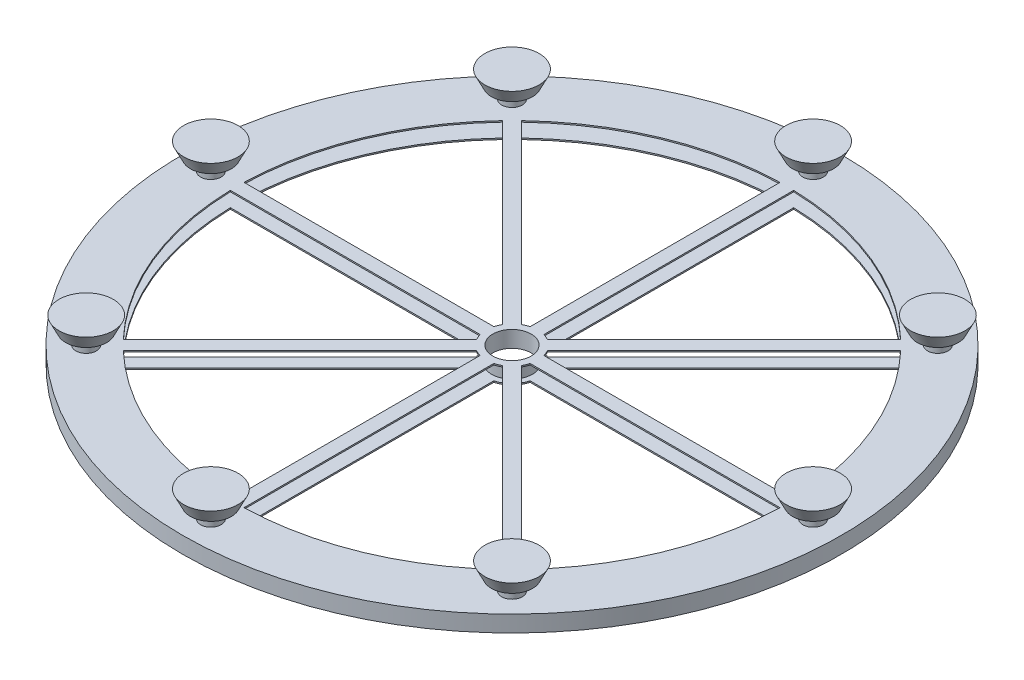
from build123d import *

# Parameters (mm, degrees)
REVOLVE_THIN1_START           = -27.94
REVOLVE_THIN1_OUTLINE_R       = 612.14
REVOLVE_THIN1_OUTLINE_R_2     = 35.56
REVOLVE_THIN1_DEPTH           = 2.54
REVOLVE_THIN1_2_OUTLINE_R     = 612.14
REVOLVE_THIN1_2_OUTLINE_R_2   = 35.56
REVOLVE_THIN1_2_DEPTH         = 2.54
REVOLVE_THIN1_START_2         = -25.4
REVOLVE_THIN1_3_OUTLINE_R     = 612.14
REVOLVE_THIN1_3_OUTLINE_R_2   = 609.6
REVOLVE_THIN1_3_OUTLINE_R_3   = 38.1
REVOLVE_THIN1_3_OUTLINE_R_4   = 35.56
REVOLVE_THIN1_3_DEPTH         = 25.4
CUT_EXTRUDE4_DEPTH            = 254
SKETCH4_R                     = 19.05
BOSS_EXTRUDE1_DEPTH           = 25.4
SKETCH5_R                     = 38.1
BOSS_EXTRUDE2_DEPTH           = 25.4
BOSS_EXTRUDE2_DRAFT           = -26
BOSS_EXTRUDE2_PROFILE_2_DEPTH = 25.4
BOSS_EXTRUDE2_PROFILE_2_DRAFT = -26
BOSS_EXTRUDE2_PROFILE_3_DEPTH = 25.4
BOSS_EXTRUDE2_PROFILE_3_DRAFT = -26
BOSS_EXTRUDE2_PROFILE_4_DEPTH = 25.4
BOSS_EXTRUDE2_PROFILE_4_DRAFT = -26
BOSS_EXTRUDE2_PROFILE_5_DEPTH = 25.4
BOSS_EXTRUDE2_PROFILE_5_DRAFT = -26
BOSS_EXTRUDE2_PROFILE_6_DEPTH = 25.4
BOSS_EXTRUDE2_PROFILE_6_DRAFT = -26
BOSS_EXTRUDE2_PROFILE_7_DEPTH = 25.4
BOSS_EXTRUDE2_PROFILE_7_DRAFT = -26
BOSS_EXTRUDE2_PROFILE_8_DEPTH = 25.4
BOSS_EXTRUDE2_PROFILE_8_DRAFT = -26
FILLET1_R                     = 2.54
FILLET2_R                     = 2.54


# Read off the part's stored shape, not the designer's step: Revolve-Thin1
with BuildPart() as part:
    # Revolve-Thin1 outline → Revolve-Thin1 (new body)
    with BuildSketch(Plane(origin=(0, 0, 0), x_dir=(1, 0, 0), z_dir=(0, 1, 0)).offset(REVOLVE_THIN1_START)):
        Circle(REVOLVE_THIN1_OUTLINE_R)
        Circle(REVOLVE_THIN1_OUTLINE_R_2, mode=Mode.SUBTRACT)
    extrude(amount=REVOLVE_THIN1_DEPTH)



with BuildPart() as body_2:
    # Revolve-Thin1 2 outline → Revolve-Thin1 2 (new body)
    with BuildSketch(Plane(origin=(0, 0, 0), x_dir=(1, 0, 0), z_dir=(0, 1, 0))):
        Circle(REVOLVE_THIN1_2_OUTLINE_R)
        Circle(REVOLVE_THIN1_2_OUTLINE_R_2, mode=Mode.SUBTRACT)
    extrude(amount=REVOLVE_THIN1_2_DEPTH)


with BuildPart() as part_1:
    add(part.part)

    add(body_2.part)  # Revolve-Thin1 3 merges body 2
    # Revolve-Thin1 3 outline → Revolve-Thin1 3 (add)
    # profile 1 of 2: a face of its own
    with BuildSketch(Plane(origin=(0, 0, 0), x_dir=(1, 0, 0), z_dir=(0, 1, 0)).offset(REVOLVE_THIN1_START_2)):
        Circle(REVOLVE_THIN1_3_OUTLINE_R)
        Circle(REVOLVE_THIN1_3_OUTLINE_R_2, mode=Mode.SUBTRACT)
    # profile 2 of 2: a face of its own
    with BuildSketch(Plane(origin=(0, 0, 0), x_dir=(1, 0, 0), z_dir=(0, 1, 0)).offset(REVOLVE_THIN1_START_2)):
        Circle(REVOLVE_THIN1_3_OUTLINE_R_3)
        Circle(REVOLVE_THIN1_3_OUTLINE_R_4, mode=Mode.SUBTRACT)
    extrude(amount=REVOLVE_THIN1_3_DEPTH)

    # Sketch3 → Cut-Extrude4 (cut)
    with BuildSketch(Plane(origin=(0, 2.54, 0), x_dir=(1, 0, 0), z_dir=(0, 1, 0))):
        with BuildLine():
            ThreePointArc((-12.707885841, 46.475796004), (-18.407169885, 44.527138619), (-23.818795726, 41.882632999))
            Line((-23.818795726, 41.882632999), (-351.960232421, 370.024069694))
            ThreePointArc((-351.960232421, 370.024069694), (-195.398846018, 471.818935963), (-12.708491222, 510.521607387))
            Line((-12.708491222, 510.521607387), (-12.707885841, 46.475796004))
        make_face()
        with BuildLine():
            Line((23.877518263, 41.849182768), (352.007030204, 369.979550847))
            ThreePointArc((352.007030204, 369.979550847), (195.458520056, 471.794218167), (12.77306183, 510.519995935))
            Line((12.77306183, 510.519995935), (12.77306183, 46.457925785))
            ThreePointArc((12.77306183, 46.457925785), (18.469607017, 44.501276312), (23.877518263, 41.849182768))
        make_face()
        with BuildLine():
            Line((46.475796004, 12.707885841), (510.521607387, 12.708491222))
            ThreePointArc((510.521607387, 12.708491222), (471.818935963, 195.398846018), (370.024069694, 351.960232421))
            Line((370.024069694, 351.960232421), (41.882632999, 23.818795726))
            ThreePointArc((41.882632999, 23.818795726), (44.527138619, 18.407169885), (46.475796004, 12.707885841))
        make_face()
        with BuildLine():
            Line((41.849182768, -23.877518263), (369.979550847, -352.007030204))
            ThreePointArc((369.979550847, -352.007030204), (471.794218167, -195.458520056), (510.519995935, -12.77306183))
            Line((510.519995935, -12.77306183), (46.457925785, -12.77306183))
            ThreePointArc((46.457925785, -12.77306183), (44.501276312, -18.469607017), (41.849182768, -23.877518263))
        make_face()
        with BuildLine():
            Line((12.707885841, -46.475796004), (12.708491222, -510.521607387))
            ThreePointArc((12.708491222, -510.521607387), (195.398846018, -471.818935963), (351.960232421, -370.024069694))
            Line((351.960232421, -370.024069694), (23.818795726, -41.882632999))
            ThreePointArc((23.818795726, -41.882632999), (18.407169885, -44.527138619), (12.707885841, -46.475796004))
        make_face()
        with BuildLine():
            Line((-23.877518263, -41.849182768), (-352.007030204, -369.979550847))
            ThreePointArc((-352.007030204, -369.979550847), (-195.458520056, -471.794218167), (-12.77306183, -510.519995935))
            Line((-12.77306183, -510.519995935), (-12.77306183, -46.457925785))
            ThreePointArc((-12.77306183, -46.457925785), (-18.469607017, -44.501276312), (-23.877518263, -41.849182768))
        make_face()
        with BuildLine():
            Line((-46.475796004, -12.707885841), (-510.521607387, -12.708491222))
            ThreePointArc((-510.521607387, -12.708491222), (-471.818935963, -195.398846018), (-370.024069694, -351.960232421))
            Line((-370.024069694, -351.960232421), (-41.882632999, -23.818795726))
            ThreePointArc((-41.882632999, -23.818795726), (-44.527138619, -18.407169885), (-46.475796004, -12.707885841))
        make_face()
        with BuildLine():
            ThreePointArc((-41.849182768, 23.877518263), (-44.501276312, 18.469607017), (-46.457925785, 12.77306183))
            Line((-46.457925785, 12.77306183), (-510.519995935, 12.77306183))
            ThreePointArc((-510.519995935, 12.77306183), (-471.794218167, 195.458520056), (-369.979550847, 352.007030204))
            Line((-369.979550847, 352.007030204), (-41.849182768, 23.877518263))
        make_face()
    extrude(amount=-CUT_EXTRUDE4_DEPTH, mode=Mode.SUBTRACT)

    # Sketch4 → Boss-Extrude1 (add)
    with BuildSketch(Plane(origin=(0, 0, 0), x_dir=(1, 0, 0), z_dir=(0, 1, 0))):
        with Locations(Location((0, 559.298368412, 0), (0, 0, 90))):
            Circle(SKETCH4_R)
        with Locations(Location((395.483669011, 395.483669011, 0), (0, 0, 90))):
            Circle(SKETCH4_R)
        with Locations(Location((559.298368412, 0, 0), (0, 0, 90))):
            Circle(SKETCH4_R)
        with Locations(Location((395.483669011, -395.483669011, 0), (0, 0, 90))):
            Circle(SKETCH4_R)
        with Locations(Location((0, -559.298368412, 0), (0, 0, 90))):
            Circle(SKETCH4_R)
        with Locations(Location((-395.483669011, -395.483669011, 0), (0, 0, 90))):
            Circle(SKETCH4_R)
        with Locations(Location((-559.298368412, 0, 0), (0, 0, 90))):
            Circle(SKETCH4_R)
        with Locations(Location((-395.483669011, 395.483669011, 0), (0, 0, 90))):
            Circle(SKETCH4_R)
    extrude(amount=BOSS_EXTRUDE1_DEPTH)


with BuildPart() as boss_extrude2_tool:
    # Sketch5 → Boss-Extrude2 (with draft: the straight prism first)
    with BuildSketch(Plane(origin=(0, 25.4, 0), x_dir=(1, 0, 0), z_dir=(0, 1, 0))):
        with Locations((0, 559.298368412)):
            Circle(SKETCH5_R)
    extrude(amount=BOSS_EXTRUDE2_DEPTH)
    # Boss-Extrude2: the draft: its side faces are tilted about the plane it starts from
    boss_extrude2_sides = [boss_extrude2_tool.faces().sort_by_distance(p)[0] for p in [
        (-38.1, 38.1, -559.298368412),
    ]]
    draft(boss_extrude2_sides, Plane(origin=(0, 25.4, 0), x_dir=(1, 0, 0), z_dir=(0, 1, 0)), BOSS_EXTRUDE2_DRAFT)


with BuildPart() as part_2:
    add(part_1.part)

    # Boss-Extrude2: add boss_extrude2_tool
    add(boss_extrude2_tool.part)


with BuildPart() as boss_extrude2_profile_2_tool:
    # Sketch5 → Boss-Extrude2 profile 2 (with draft: the straight prism first)
    with BuildSketch(Plane(origin=(0, 25.4, 0), x_dir=(1, 0, 0), z_dir=(0, 1, 0))):
        with Locations((395.483669011, 395.483669011)):
            Circle(SKETCH5_R)
    extrude(amount=BOSS_EXTRUDE2_PROFILE_2_DEPTH)
    # Boss-Extrude2 profile 2: the draft: its side faces are tilted about the plane it starts from
    boss_extrude2_profile_2_sides = [boss_extrude2_profile_2_tool.faces().sort_by_distance(p)[0] for p in [
        (357.383669011, 38.1, -395.483669011),
    ]]
    draft(boss_extrude2_profile_2_sides, Plane(origin=(0, 25.4, 0), x_dir=(1, 0, 0), z_dir=(0, 1, 0)), BOSS_EXTRUDE2_PROFILE_2_DRAFT)


with BuildPart() as part_3:
    add(part_2.part)

    # Boss-Extrude2 profile 2: add boss_extrude2_profile_2_tool
    add(boss_extrude2_profile_2_tool.part)


with BuildPart() as boss_extrude2_profile_3_tool:
    # Sketch5 → Boss-Extrude2 profile 3 (with draft: the straight prism first)
    with BuildSketch(Plane(origin=(0, 25.4, 0), x_dir=(1, 0, 0), z_dir=(0, 1, 0))):
        with Locations((559.298368412, 0)):
            Circle(SKETCH5_R)
    extrude(amount=BOSS_EXTRUDE2_PROFILE_3_DEPTH)
    # Boss-Extrude2 profile 3: the draft: its side faces are tilted about the plane it starts from
    boss_extrude2_profile_3_sides = [boss_extrude2_profile_3_tool.faces().sort_by_distance(p)[0] for p in [
        (521.198368412, 38.1, 0),
    ]]
    draft(boss_extrude2_profile_3_sides, Plane(origin=(0, 25.4, 0), x_dir=(1, 0, 0), z_dir=(0, 1, 0)), BOSS_EXTRUDE2_PROFILE_3_DRAFT)


with BuildPart() as part_4:
    add(part_3.part)

    # Boss-Extrude2 profile 3: add boss_extrude2_profile_3_tool
    add(boss_extrude2_profile_3_tool.part)


with BuildPart() as boss_extrude2_profile_4_tool:
    # Sketch5 → Boss-Extrude2 profile 4 (with draft: the straight prism first)
    with BuildSketch(Plane(origin=(0, 25.4, 0), x_dir=(1, 0, 0), z_dir=(0, 1, 0))):
        with Locations((395.483669011, -395.483669011)):
            Circle(SKETCH5_R)
    extrude(amount=BOSS_EXTRUDE2_PROFILE_4_DEPTH)
    # Boss-Extrude2 profile 4: the draft: its side faces are tilted about the plane it starts from
    boss_extrude2_profile_4_sides = [boss_extrude2_profile_4_tool.faces().sort_by_distance(p)[0] for p in [
        (357.383669011, 38.1, 395.483669011),
    ]]
    draft(boss_extrude2_profile_4_sides, Plane(origin=(0, 25.4, 0), x_dir=(1, 0, 0), z_dir=(0, 1, 0)), BOSS_EXTRUDE2_PROFILE_4_DRAFT)


with BuildPart() as part_5:
    add(part_4.part)

    # Boss-Extrude2 profile 4: add boss_extrude2_profile_4_tool
    add(boss_extrude2_profile_4_tool.part)


with BuildPart() as boss_extrude2_profile_5_tool:
    # Sketch5 → Boss-Extrude2 profile 5 (with draft: the straight prism first)
    with BuildSketch(Plane(origin=(0, 25.4, 0), x_dir=(1, 0, 0), z_dir=(0, 1, 0))):
        with Locations((0, -559.298368412)):
            Circle(SKETCH5_R)
    extrude(amount=BOSS_EXTRUDE2_PROFILE_5_DEPTH)
    # Boss-Extrude2 profile 5: the draft: its side faces are tilted about the plane it starts from
    boss_extrude2_profile_5_sides = [boss_extrude2_profile_5_tool.faces().sort_by_distance(p)[0] for p in [
        (-38.1, 38.1, 559.298368412),
    ]]
    draft(boss_extrude2_profile_5_sides, Plane(origin=(0, 25.4, 0), x_dir=(1, 0, 0), z_dir=(0, 1, 0)), BOSS_EXTRUDE2_PROFILE_5_DRAFT)


with BuildPart() as part_6:
    add(part_5.part)

    # Boss-Extrude2 profile 5: add boss_extrude2_profile_5_tool
    add(boss_extrude2_profile_5_tool.part)


with BuildPart() as boss_extrude2_profile_6_tool:
    # Sketch5 → Boss-Extrude2 profile 6 (with draft: the straight prism first)
    with BuildSketch(Plane(origin=(0, 25.4, 0), x_dir=(1, 0, 0), z_dir=(0, 1, 0))):
        with Locations((-395.48366901, -395.483669011)):
            Circle(SKETCH5_R)
    extrude(amount=BOSS_EXTRUDE2_PROFILE_6_DEPTH)
    # Boss-Extrude2 profile 6: the draft: its side faces are tilted about the plane it starts from
    boss_extrude2_profile_6_sides = [boss_extrude2_profile_6_tool.faces().sort_by_distance(p)[0] for p in [
        (-433.583669011, 38.1, 395.483669011),
    ]]
    draft(boss_extrude2_profile_6_sides, Plane(origin=(0, 25.4, 0), x_dir=(1, 0, 0), z_dir=(0, 1, 0)), BOSS_EXTRUDE2_PROFILE_6_DRAFT)


with BuildPart() as part_7:
    add(part_6.part)

    # Boss-Extrude2 profile 6: add boss_extrude2_profile_6_tool
    add(boss_extrude2_profile_6_tool.part)


with BuildPart() as boss_extrude2_profile_7_tool:
    # Sketch5 → Boss-Extrude2 profile 7 (with draft: the straight prism first)
    with BuildSketch(Plane(origin=(0, 25.4, 0), x_dir=(1, 0, 0), z_dir=(0, 1, 0))):
        with Locations((-559.298368412, 0)):
            Circle(SKETCH5_R)
    extrude(amount=BOSS_EXTRUDE2_PROFILE_7_DEPTH)
    # Boss-Extrude2 profile 7: the draft: its side faces are tilted about the plane it starts from
    boss_extrude2_profile_7_sides = [boss_extrude2_profile_7_tool.faces().sort_by_distance(p)[0] for p in [
        (-597.398368412, 38.1, 0),
    ]]
    draft(boss_extrude2_profile_7_sides, Plane(origin=(0, 25.4, 0), x_dir=(1, 0, 0), z_dir=(0, 1, 0)), BOSS_EXTRUDE2_PROFILE_7_DRAFT)


with BuildPart() as part_8:
    add(part_7.part)

    # Boss-Extrude2 profile 7: add boss_extrude2_profile_7_tool
    add(boss_extrude2_profile_7_tool.part)


with BuildPart() as boss_extrude2_profile_8_tool:
    # Sketch5 → Boss-Extrude2 profile 8 (with draft: the straight prism first)
    with BuildSketch(Plane(origin=(0, 25.4, 0), x_dir=(1, 0, 0), z_dir=(0, 1, 0))):
        with Locations((-395.483669011, 395.483669011)):
            Circle(SKETCH5_R)
    extrude(amount=BOSS_EXTRUDE2_PROFILE_8_DEPTH)
    # Boss-Extrude2 profile 8: the draft: its side faces are tilted about the plane it starts from
    boss_extrude2_profile_8_sides = [boss_extrude2_profile_8_tool.faces().sort_by_distance(p)[0] for p in [
        (-433.583669011, 38.1, -395.483669011),
    ]]
    draft(boss_extrude2_profile_8_sides, Plane(origin=(0, 25.4, 0), x_dir=(1, 0, 0), z_dir=(0, 1, 0)), BOSS_EXTRUDE2_PROFILE_8_DRAFT)


with BuildPart() as part_9:
    add(part_8.part)

    # Boss-Extrude2 profile 8: add boss_extrude2_profile_8_tool
    add(boss_extrude2_profile_8_tool.part)

    # Fillet1
    fillet1_edges = [part_9.edges().sort_by_distance(p)[0] for p in [
        (559.298368412, 25.4, 19.05),
    ]]
    fillet(fillet1_edges, radius=FILLET1_R)

    # Fillet2
    fillet2_edges = [part_9.edges().sort_by_distance(p)[0] for p in [
        (0, 25.4, -540.248368412),
        (395.483669011, 25.4, -376.433669011),
        (395.483669011, 25.4, 414.533669011),
        (0, 25.4, 578.348368412),
        (-395.483669011, 25.4, 414.533669011),
        (-559.298368412, 25.4, 19.05),
        (-395.483669011, 25.4, -376.433669011),
    ]]
    fillet(fillet2_edges, radius=FILLET2_R)


solid = part_9.part
